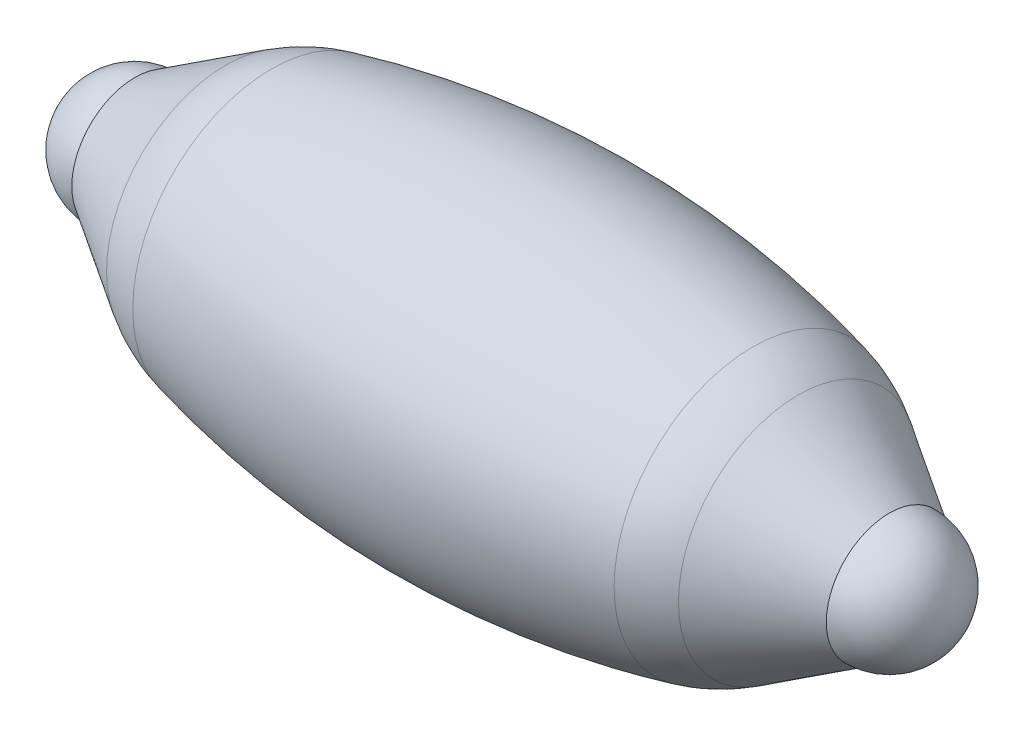
from build123d import *

# Parameters (mm, degrees)
FASE1_SIZE                      = 1
FASE2_SIZE                      = 1
SKIZZE4_R                       = 2
AUFSATZ_LINEAR_AUSTRAGEN2_DEPTH = 2
VERRUNDUNG6_R                   = 2
AUFSATZ_LINEAR_START            = 2
SKIZZE5_R                       = 2
AUFSATZ_LINEAR_AUSTRAGEN3_DEPTH = 2
VERRUNDUNG7_R                   = 2
VERRUNDUNG8_R                   = 5


# Some blends are built 0.0001 mm under size
with BuildPart() as part:
    # Skizze2 → Rotation1 (revolve)
    with BuildSketch(Plane.XY, mode=Mode.PRIVATE) as rotation1_sk:
        with BuildLine():
            Line((-11.987410989, 29.669883346), (-11.987410989, 26.669883346))
            Line((-11.987410989, 26.669883346), (11.987410989, 26.669883346))
            Line((11.987410989, 26.669883346), (11.987410989, 29.669883346))
            ThreePointArc((11.987410989, 29.669883346), (0, 32), (-11.987410989, 29.669883346))
        make_face()
    revolve(rotation1_sk.sketch.rotate(Axis((-11.987410989, 26.669883346, 0), (1, 0, 0)), 180), axis=Axis((-11.987410989, 26.669883346, 0), (1, 0, 0)))

    # Fase1
    # the kernel refuses this chamfer: 5, 1 mm, written as the material it takes off along each edge
    with BuildSketch(Plane(origin=(-11.987410989, 26.669883346, 0), x_dir=(0, -1, 0), z_dir=(0, 0, 1))) as fase1_piece_1:
        with BuildLine():
            Line((4.195911394, 3.543317486), (3 - FASE1_SIZE, 0))
            Line((3 - FASE1_SIZE, 0), (3, 0))
            ThreePointArc((3, 0), (3.680793528, 1.846581965), (4.195911394, 3.543317486))
        make_face()
    revolve(axis=Axis((-11.987410989, 26.669883346, 0), (1, 0, 0)), mode=Mode.SUBTRACT)

    # Fase2
    # the kernel refuses this chamfer: 5, 1 mm, written as the material it takes off along each edge
    with BuildSketch(Plane(origin=(11.987410989, 26.669883346, 0), x_dir=(0, -1, 0), z_dir=(0, 0, 1))) as fase2_piece_1:
        with BuildLine():
            Line((4.195911394, -3.543317486), (3 - FASE2_SIZE, 0))
            Line((3 - FASE2_SIZE, 0), (3, 0))
            ThreePointArc((3, 0), (3.680793528, -1.846581965), (4.195911394, -3.543317486))
        make_face()
    revolve(axis=Axis((11.987410989, 26.669883346, 0), (1, 0, 0)), mode=Mode.SUBTRACT)

    # Skizze4 → Aufsatz-Linear austragen2 (add)
    with BuildSketch(Plane.ZY.offset(11.987410989)):
        with Locations(Location((0, 26.669883346, 0), (0, 0, 90))):
            Circle(SKIZZE4_R)
    extrude(amount=AUFSATZ_LINEAR_AUSTRAGEN2_DEPTH)

    # Verrundung6
    verrundung6_edges = [part.edges().sort_by_distance(p)[0] for p in [
        (-13.987410989, 24.669883346, 0),
    ]]
    fillet(verrundung6_edges, radius=VERRUNDUNG6_R - 0.0001)  # a hair under: the kernel refuses the full size

    # Skizze5 → Aufsatz-Linear austragen3 (add)
    with BuildSketch(Plane(origin=(11.987410989, 0, 0), x_dir=(0, 0, -1), z_dir=(1, 0, 0)).offset(AUFSATZ_LINEAR_START)):
        with Locations(Location((0, 26.669883346, 0), (0, 0, 270))):
            Circle(SKIZZE5_R)
    extrude(amount=-AUFSATZ_LINEAR_AUSTRAGEN3_DEPTH)

    # Verrundung7
    verrundung7_edges = [part.edges().sort_by_distance(p)[0] for p in [
        (13.987410989, 28.669883346, 0),
    ]]
    fillet(verrundung7_edges, radius=VERRUNDUNG7_R - 0.0001)  # a hair under: the kernel refuses the full size

    # Verrundung8
    verrundung8_edges = [part.edges().sort_by_distance(p)[0] for p in [
        (-8.444093503, 30.86579474, 0),
        (8.444093503, 30.86579474, 0),
    ]]
    fillet(verrundung8_edges, radius=VERRUNDUNG8_R)


solid = part.part
